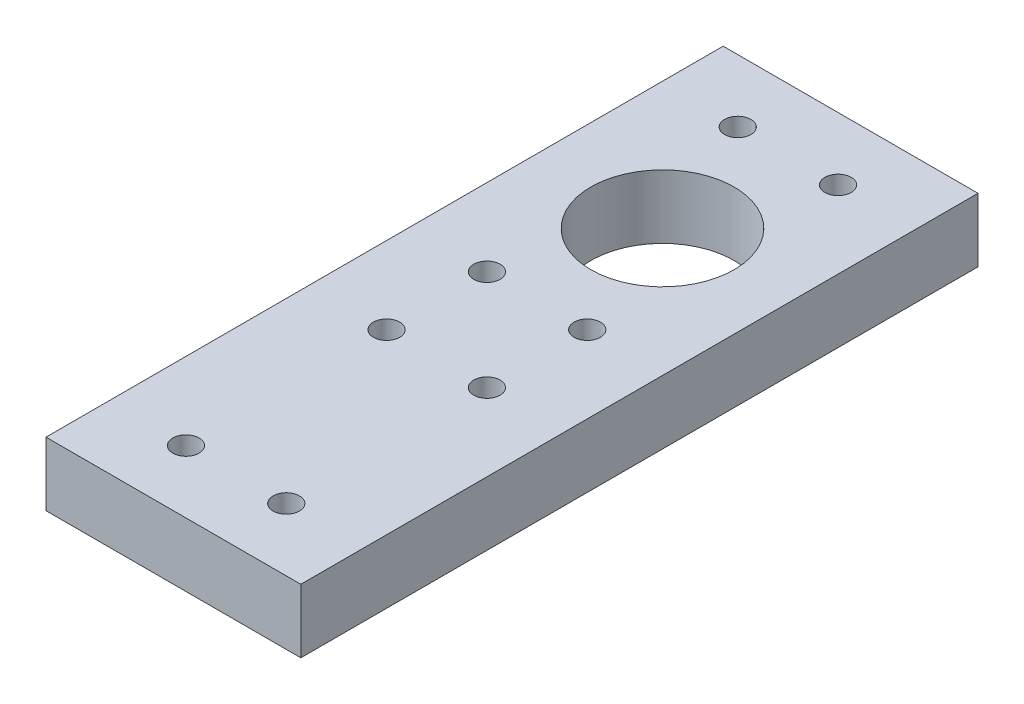
from build123d import *

# Parameters (mm, degrees)
SKETCH2_W           = 101.6
SKETCH2_H           = 270
BOSS_EXTRUDE1_DEPTH = 25.4
SKETCH3_R           = 5.25
SKETCH3_R_2         = 28.575
CUT_EXTRUDE1_DEPTH  = 25.4
SKETCH4_R           = 5.25
CUT_EXTRUDE2_DEPTH  = 25.4


with BuildPart() as part:
    # Sketch2 → Boss-Extrude1 (new body)
    with BuildSketch(Plane(origin=(0, 0, 0), x_dir=(1, 0, 0), z_dir=(0, 1, 0))):
        with Locations((50.8, 135)):
            Rectangle(SKETCH2_W, SKETCH2_H)
    extrude(amount=BOSS_EXTRUDE1_DEPTH)

    # Sketch3 → Cut-Extrude1 (cut)
    with BuildSketch(Plane(origin=(0, 25.4, 0), x_dir=(1, 0, 0), z_dir=(0, 1, 0))):
        with Locations((70.8, 245)):
            Circle(SKETCH3_R)
        with Locations((30.8, 245)):
            Circle(SKETCH3_R)
        with Locations((70.8, 145)):
            Circle(SKETCH3_R)
        with Locations((30.8, 145)):
            Circle(SKETCH3_R)
        with Locations((50.8, 195)):
            Circle(SKETCH3_R_2)
    extrude(amount=-CUT_EXTRUDE1_DEPTH, mode=Mode.SUBTRACT)

    # Sketch4 → Cut-Extrude2 (cut)
    with BuildSketch(Plane(origin=(0, 25.4, 0), x_dir=(1, 0, 0), z_dir=(0, 1, 0))):
        with Locations((70.8, 105)):
            Circle(SKETCH4_R)
        with Locations((30.8, 105)):
            Circle(SKETCH4_R)
        with Locations((30.8, 25)):
            Circle(SKETCH4_R)
        with Locations((70.8, 25)):
            Circle(SKETCH4_R)
    extrude(amount=-CUT_EXTRUDE2_DEPTH, mode=Mode.SUBTRACT)


solid = part.part
